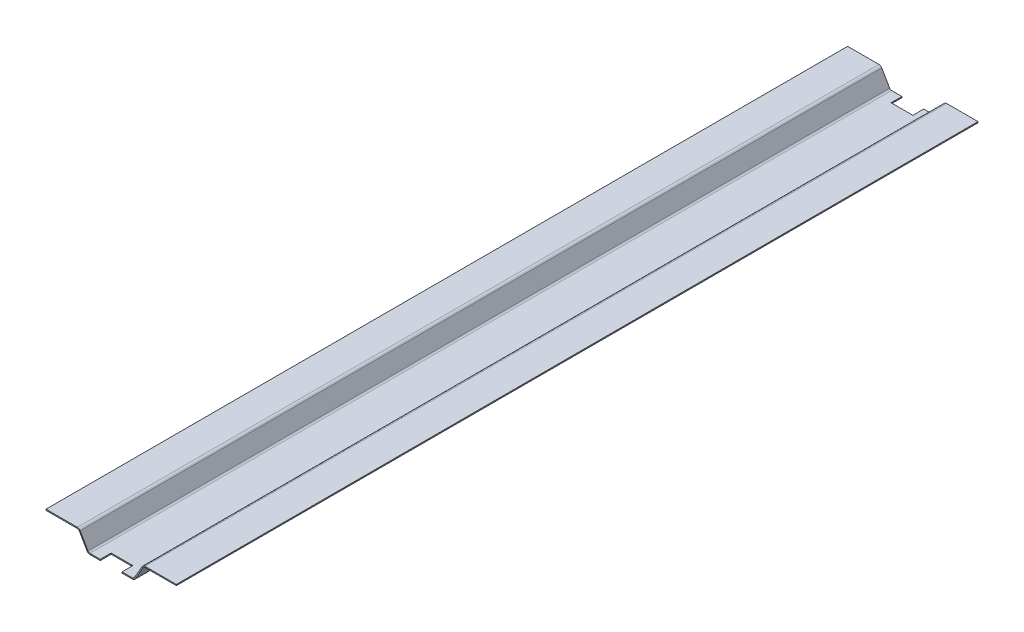
from build123d import *

# Parameters (mm, degrees)
BASE_FLANGE1_DEPTH = 369
CUT_EXTRUDE1_REACH = 376.147
SKETCH2_W          = 20
SKETCH2_H          = 10


# Sheet-metal steps are written as plain solids
with BuildPart() as part:
    # Sketch1 → Base-Flange1 (new, symmetric)
    with BuildSketch(Plane.XY):
        with BuildLine():
            Line((-60, 15), (-31.154700538, 15))
            ThreePointArc((-31.154700538, 15), (-30.154700538, 14.732050808), (-29.422649731, 14))
            Line((-29.422649731, 14), (-22.205771366, 1.5))
            ThreePointArc((-22.205771366, 1.5), (-21.107695155, 0.401923789), (-19.607695155, 0))
            Line((-19.607695155, 0), (19.607695155, 0))
            ThreePointArc((19.607695155, 0), (21.107695155, 0.401923789), (22.205771366, 1.5))
            Line((22.205771366, 1.5), (29.422649731, 14))
            ThreePointArc((29.422649731, 14), (30.154700538, 14.732050808), (31.154700538, 15))
            Line((31.154700538, 15), (60, 15))
            Line((60, 15), (60, 16))
            Line((60, 16), (31.154700538, 16))
            ThreePointArc((31.154700538, 16), (29.654700538, 15.598076211), (28.556624327, 14.5))
            Line((28.556624327, 14.5), (21.339745962, 2))
            ThreePointArc((21.339745962, 2), (20.607695155, 1.267949192), (19.607695155, 1))
            Line((19.607695155, 1), (-19.607695155, 1))
            ThreePointArc((-19.607695155, 1), (-20.607695155, 1.267949192), (-21.339745962, 2))
            Line((-21.339745962, 2), (-28.556624327, 14.5))
            ThreePointArc((-28.556624327, 14.5), (-29.654700538, 15.598076211), (-31.154700538, 16))
            Line((-31.154700538, 16), (-60, 16))
            Line((-60, 16), (-60, 15))
        make_face()
    extrude(amount=BASE_FLANGE1_DEPTH, both=True)

    # Sketch2 → Cut-Extrude1 (cut, up to next)
    with BuildSketch(Plane(origin=(0, 1, 0), x_dir=(1, 0, 0), z_dir=(0, 1, 0)), mode=Mode.PRIVATE) as cut_extrude1_sk1:
        with Locations((0, 364)):
            Rectangle(SKETCH2_W, SKETCH2_H)
    cut_extrude1_tool1 = extrude(cut_extrude1_sk1.sketch, amount=-CUT_EXTRUDE1_REACH, mode=Mode.PRIVATE) & part.part
    # Sketch2 → Cut-Extrude1 (cut, up to next)
    with BuildSketch(Plane(origin=(0, 1, 0), x_dir=(1, 0, 0), z_dir=(0, 1, 0)), mode=Mode.PRIVATE) as cut_extrude1_sk2:
        with Locations((0, -364)):
            Rectangle(SKETCH2_W, SKETCH2_H)
    cut_extrude1_tool2 = extrude(cut_extrude1_sk2.sketch, amount=-CUT_EXTRUDE1_REACH, mode=Mode.PRIVATE) & part.part
    add(cut_extrude1_tool1.solids().sort_by_distance((0, 1, -364))[0], mode=Mode.SUBTRACT)
    add(cut_extrude1_tool2.solids().sort_by_distance((0, 1, 364))[0], mode=Mode.SUBTRACT)


solid = part.part
